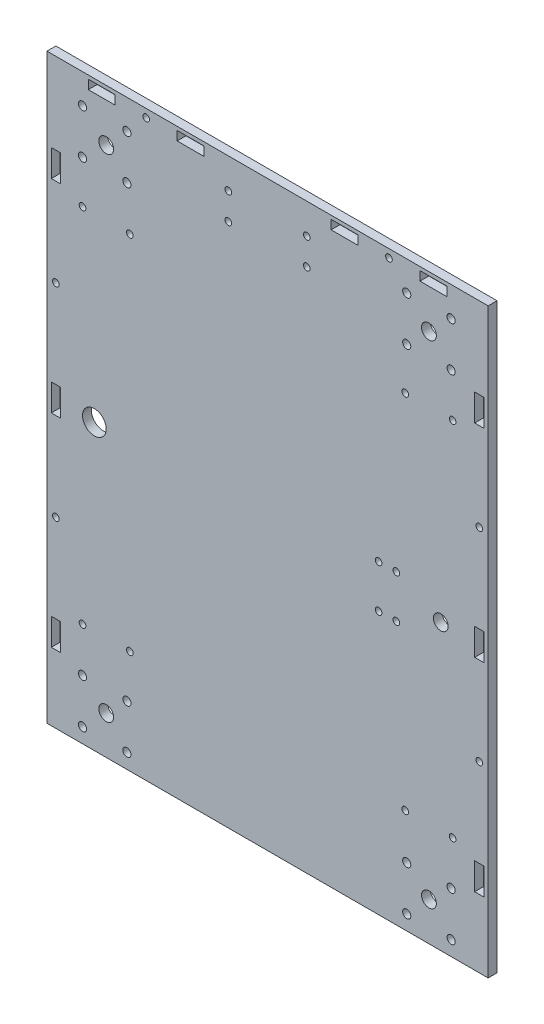
from build123d import *

# Parameters (mm, degrees)
SKETCH_3_W                  = 270
SKETCH_3_H                  = 384.2
EXTRUDE_1_DEPTH             = 6
SKETCH_4_R                  = 5
CUT_EXTRUDE_1_DEPTH         = 235.86892089
PATTERN_LINEAR_1_COUNT      = 2
PATTERN_LINEAR_1_PITCH      = 218
PATTERN_LINEAR_1_COUNT_DIR2 = 2
PATTERN_LINEAR_1_PITCH_DIR2 = 332.2
SKETCH_7_R                  = 2.25
CUT_EXTRUDE_2_DEPTH         = 235.86892089
SKETCH_8_R                  = 2.25
CUT_EXTRUDE_3_DEPTH         = 235.86892089
PATTERN_LINEAR_2_COUNT      = 2
PATTERN_LINEAR_2_PITCH      = 244.2
PATTERN_LINEAR_2_COUNT_DIR2 = 2
PATTERN_LINEAR_2_PITCH_DIR2 = 218
SKETCH_10_R                 = 2.75
CUT_EXTRUDE_4_DEPTH         = 235.86892089
PATTERN_LINEAR_3_COUNT      = 2
PATTERN_LINEAR_3_PITCH      = 219
PATTERN_LINEAR_3_COUNT_DIR2 = 2
PATTERN_LINEAR_3_PITCH_DIR2 = 333.2
MOVE_FACE_6373_BY           = 14
MOVE_FACE_6417_BY           = 14
SKETCH_11_R                 = 2.25
CUT_EXTRUDE_5_DEPTH         = 10
CUT_EXTRUDE_4_2_DEPTH       = 244.185957654
CUT_EXTRUDE_4_2_DEPTH_BACK  = 244.185957654
SKETCH_4_2_R                = 2.25
SKETCH_4_2_W                = 6.15
SKETCH_4_2_H                = 18.15
SKETCH_7574_W               = 298
SKETCH_7574_H               = 10
EXTRUDE_7579_DEPTH          = 6
CUT_EXTRUDE_4_3_DEPTH       = 251.356166291
CUT_EXTRUDE_4_3_DEPTH_BACK  = 251.356166291
SKETCH_4_3_R                = 2.25
SKETCH_4_3_W                = 18.15
SKETCH_4_3_H                = 6.15
SKETCH_16_R                 = 8
SKETCH_16_R_2               = 5
CUT_EXTRUDE_8_DEPTH         = 10


with BuildPart() as part:
    # Эскиз3 → Бобышка-Вытянуть1 (new body)
    with BuildSketch(Plane.XY):
        Rectangle(SKETCH_3_W, SKETCH_3_H)
    extrude(amount=EXTRUDE_1_DEPTH)

    # Sketch 4 → Вырез-Вытянуть1 (cut, through all)
    with BuildSketch(Plane.XY.offset(6)):
        with Locations((-109, 166.1)):
            Circle(SKETCH_4_R)
    cut_extrude_1 = extrude(amount=-CUT_EXTRUDE_1_DEPTH, mode=Mode.SUBTRACT)

    # Линейный массив1: Cut-Extrude 1 2 × 2
    with Locations(*[(i * PATTERN_LINEAR_1_PITCH, -j * PATTERN_LINEAR_1_PITCH_DIR2, 0) for i in range(PATTERN_LINEAR_1_COUNT) for j in range(PATTERN_LINEAR_1_COUNT_DIR2) if (i, j) != (0, 0)]):
        add(cut_extrude_1, mode=Mode.SUBTRACT)

    # Эскиз7 → Вырез-Вытянуть2 (cut, through all)
    with BuildSketch(Plane(origin=(0, 0, 0), x_dir=(-1, 0, 0), z_dir=(0, 0, -1))):
        with Locations((-26.5, 180.6)):
            Circle(SKETCH_7_R)
        with Locations((26.5, 180.6)):
            Circle(SKETCH_7_R)
        with Locations((-26.5, 162.6)):
            Circle(SKETCH_7_R)
        with Locations((26.5, 162.6)):
            Circle(SKETCH_7_R)
    extrude(amount=-CUT_EXTRUDE_2_DEPTH, mode=Mode.SUBTRACT)

    # Эскиз8 → Вырез-Вытянуть3 (cut, through all)
    with BuildSketch(Plane(origin=(0, 0, 0), x_dir=(-1, 0, 0), z_dir=(0, 0, -1))):
        with Locations((93, 122.1)):
            Circle(SKETCH_8_R)
        with Locations((125, 122.1)):
            Circle(SKETCH_8_R)
    cut_extrude_3 = extrude(amount=-CUT_EXTRUDE_3_DEPTH, mode=Mode.SUBTRACT)

    # Линейный массив2: Cut-Extrude 3 2 × 2
    with Locations(*[(j * PATTERN_LINEAR_2_PITCH_DIR2, -i * PATTERN_LINEAR_2_PITCH, 0) for i in range(PATTERN_LINEAR_2_COUNT) for j in range(PATTERN_LINEAR_2_COUNT_DIR2) if (i, j) != (0, 0)]):
        add(cut_extrude_3, mode=Mode.SUBTRACT)

    # Эскиз10 → Cut-Extrude 4 (cut, through all)
    with BuildSketch(Plane(origin=(0, 0, 0), x_dir=(-1, 0, 0), z_dir=(0, 0, -1))):
        with Locations((-124, 181.1)):
            Circle(SKETCH_10_R)
        with Locations((-94, 181.1)):
            Circle(SKETCH_10_R)
        with Locations((-94, 151.1)):
            Circle(SKETCH_10_R)
        with Locations((-124, 151.1)):
            Circle(SKETCH_10_R)
    cut_extrude_4 = extrude(amount=-CUT_EXTRUDE_4_DEPTH, mode=Mode.SUBTRACT)

    # Линейный массив3: Cut-Extrude 4 2 × 2
    with Locations(*[(-i * PATTERN_LINEAR_3_PITCH, -j * PATTERN_LINEAR_3_PITCH_DIR2, 0) for i in range(PATTERN_LINEAR_3_COUNT) for j in range(PATTERN_LINEAR_3_COUNT_DIR2) if (i, j) != (0, 0)]):
        add(cut_extrude_4, mode=Mode.SUBTRACT)

    # Move Face 6373: a face moved outward by 14.0
    extrude(part.faces().sort_by_distance((-135, 0, 3))[0], amount=MOVE_FACE_6373_BY, dir=(-1, 0, 0))

    # Move Face 6417: a face moved outward by 14.0
    extrude(part.faces().sort_by_distance((135, 0, 3))[0], amount=MOVE_FACE_6417_BY, dir=(1, 0, 0))

    # Эскиз11 → Вырез-Вытянуть5 (cut)
    with BuildSketch(Plane(origin=(0, 0, 0), x_dir=(-1, 0, 0), z_dir=(0, 0, -1))):
        with Locations((-87.000000002, 14.499999998)):
            Circle(SKETCH_11_R)
        with Locations((-75.000000002, 14.499999998)):
            Circle(SKETCH_11_R)
        with Locations((-75.000000002, -14.500000002)):
            Circle(SKETCH_11_R)
        with Locations((-87.000000002, -14.500000002)):
            Circle(SKETCH_11_R)
    extrude(amount=-CUT_EXTRUDE_5_DEPTH, mode=Mode.SUBTRACT)

    # Sketch 4 2 → Cut-Extrude 4 2 (cut, two sides: drawn at the far end of the back side and taken through both)
    with BuildSketch(Plane.XY.offset(-CUT_EXTRUDE_4_2_DEPTH_BACK)):
        with Locations((-143, -68.55)):
            Circle(SKETCH_4_2_R)
        with Locations((-143, 68.55)):
            Circle(SKETCH_4_2_R)
        with Locations((143, -68.55)):
            Circle(SKETCH_4_2_R)
        with Locations((143, 68.55)):
            Circle(SKETCH_4_2_R)
        with Locations((-143, -137.1)):
            Rectangle(SKETCH_4_2_W, SKETCH_4_2_H)
        with Locations((-143, 0)):
            Rectangle(SKETCH_4_2_W, SKETCH_4_2_H)
        with Locations((-143, 137.1)):
            Rectangle(SKETCH_4_2_W, SKETCH_4_2_H)
        with Locations((143, -137.1)):
            Rectangle(SKETCH_4_2_W, SKETCH_4_2_H)
        with Locations((143, 0)):
            Rectangle(SKETCH_4_2_W, SKETCH_4_2_H)
        with Locations((143, 137.1)):
            Rectangle(SKETCH_4_2_W, SKETCH_4_2_H)
    extrude(amount=CUT_EXTRUDE_4_2_DEPTH + CUT_EXTRUDE_4_2_DEPTH_BACK, mode=Mode.SUBTRACT)

    # Sketch 7574 → Extrude 7579 (add)
    with BuildSketch(Plane.XY):
        with Locations((0, 196.1)):
            Rectangle(SKETCH_7574_W, SKETCH_7574_H)
    extrude(amount=EXTRUDE_7579_DEPTH)

    # Sketch 4 3 → Cut-Extrude 4 3 (cut, two sides: drawn at the far end of the back side and taken through both)
    with BuildSketch(Plane.XY.offset(-CUT_EXTRUDE_4_3_DEPTH_BACK)):
        with Locations((-82, 195.6)):
            Circle(SKETCH_4_3_R)
        with Locations((82, 195.6)):
            Circle(SKETCH_4_3_R)
        with Locations((-52, 195.6)):
            Rectangle(SKETCH_4_3_W, SKETCH_4_3_H)
        with Locations((-112, 195.6)):
            Rectangle(SKETCH_4_3_W, SKETCH_4_3_H)
        with Locations((52, 195.6)):
            Rectangle(SKETCH_4_3_W, SKETCH_4_3_H)
        with Locations((112, 195.6)):
            Rectangle(SKETCH_4_3_W, SKETCH_4_3_H)
    extrude(amount=CUT_EXTRUDE_4_3_DEPTH + CUT_EXTRUDE_4_3_DEPTH_BACK, mode=Mode.SUBTRACT)

    # Эскиз16 → Вырез-Вытянуть8 (cut)
    with BuildSketch(Plane(origin=(0, 0, 0), x_dir=(-1, 0, 0), z_dir=(0, 0, -1))):
        with Locations((116.999999998, -2e-09)):
            Circle(SKETCH_16_R)
        with Locations((-117.000000002, -2e-09)):
            Circle(SKETCH_16_R_2)
    extrude(amount=-CUT_EXTRUDE_8_DEPTH, mode=Mode.SUBTRACT)


solid = part.part
